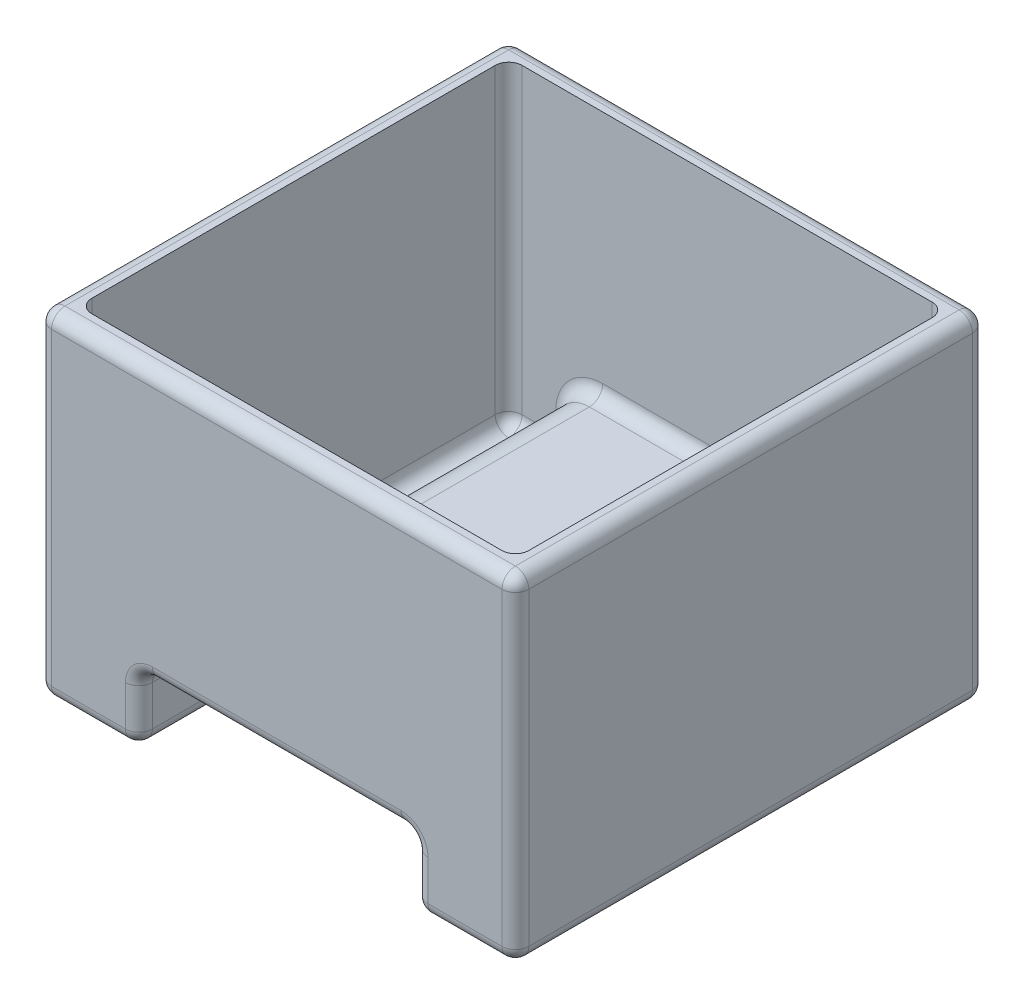
from build123d import *

# Parameters (mm, degrees)
BOSS_EXTRU_2_DEPTH = 70
CONG_4_R           = 2
CONG_3_R           = 2
CONG_5_R           = 2
CONG_6_R           = 2
COQUE1_START       = 3
COQUE1_DEPTH       = 64
CONG_7_R           = 2
CONG_8_R           = 2
CONG_11_R          = 2
CONG_12_R          = 2
CONG_13_R          = 2


# Read off the part's stored shape, not the designer's step: Coque1
with BuildPart() as part:
    # Esquisse2 → Boss.-Extru.2 (new body)
    with BuildSketch(Plane.XY):
        Polygon((-35.5, 10), (-20.5, 10), (-20.5, 20), (20.5, 20), (20.5, 10), (35.5, 10), (35.5, 60), (-35.5, 60), align=None)
    extrude(amount=BOSS_EXTRU_2_DEPTH)

    # Congé4
    cong_4_edges = [part.edges().sort_by_distance(p)[0] for p in [
        (-35.5, 60, 35),
    ]]
    fillet(cong_4_edges, radius=CONG_4_R)

    # Congé3
    cong_3_edges = [part.edges().sort_by_distance(p)[0] for p in [
        (35.5, 60, 35),
    ]]
    fillet(cong_3_edges, radius=CONG_3_R)

    # Congé5
    cong_5_edges = [part.edges().sort_by_distance(p)[0] for p in [
        (20.5, 20, 35),
    ]]
    fillet(cong_5_edges, radius=CONG_5_R)

    # Congé6
    cong_6_edges = [part.edges().sort_by_distance(p)[0] for p in [
        (-20.5, 20, 35),
    ]]
    fillet(cong_6_edges, radius=CONG_6_R)

    # Coque1 outline → Coque1 (cut)
    with BuildSketch(Plane.XY.offset(COQUE1_START)):
        with BuildLine():
            Line((-32.5, 60), (-32.5, 13))
            Line((-32.5, 13), (-23.5, 13))
            Line((-23.5, 13), (-23.5, 18))
            ThreePointArc((-23.5, 18), (-22.035533906, 21.535533906), (-18.5, 23))
            Line((-18.5, 23), (18.5, 23))
            ThreePointArc((18.5, 23), (22.035533906, 21.535533906), (23.5, 18))
            Line((23.5, 18), (23.5, 13))
            Line((23.5, 13), (32.5, 13))
            Line((32.5, 13), (32.5, 60))
            Line((32.5, 60), (-32.5, 60))
        make_face()
    extrude(amount=COQUE1_DEPTH, mode=Mode.SUBTRACT)

    # Congé7
    cong_7_edges = [part.edges().sort_by_distance(p)[0] for p in [
        (35.5, 34, 0),
        (34.914213562, 59.414213562, 0),
        (0, 60, 0),
        (-34.914213562, 59.414213562, 0),
        (-28, 10, 0),
        (-35.5, 10, 35),
        (-35.5, 34, 0),
    ]]
    fillet(cong_7_edges, radius=CONG_7_R)

    # Congé8
    cong_8_edges = [part.edges().sort_by_distance(p)[0] for p in [
        (-20.5, 14, 70),
        (35.5, 10, 36),
        (20.5, 10, 35),
        (-20.5, 10, 36),
        (28, 10, 70),
        (35.5, 34, 70),
        (-35.5, 35, 70),
        (-34.914213562, 59.414213562, 70),
        (0, 60, 70),
        (34.914213562, 59.414213562, 70),
        (20.5, 14, 0),
        (20.5, 14, 70),
        (19.914213562, 19.414213562, 0),
        (19.914213562, 19.414213562, 70),
        (0, 20, 0),
        (0, 20, 70),
        (-19.914213562, 19.414213562, 0),
        (-19.914213562, 19.414213562, 70),
        (-20.5, 15, 0),
        (34.914213562, 10, 0.585786438),
        (-27, 10, 70),
        (-20.5, 10.585786438, 0.585786438),
        (-34.914213562, 10.585786438, 70),
        (27, 10, 0),
    ]]
    fillet(cong_8_edges, radius=CONG_8_R)

    # Congé11
    cong_11_edges = [part.edges().sort_by_distance(p)[0] for p in [
        (-23.5, 15.5, 3),
        (0, 23, 3),
        (23.5, 15.5, 3),
        (-23.5, 15.5, 67),
        (-22.035533906, 21.535533906, 67),
        (0, 23, 67),
        (22.035533906, 21.535533906, 67),
        (23.5, 15.5, 67),
        (22.035533906, 21.535533906, 3),
        (-22.035533906, 21.535533906, 3),
    ]]
    fillet(cong_11_edges, radius=CONG_11_R)

    # Congé12
    cong_12_edges = [part.edges().sort_by_distance(p)[0] for p in [
        (-32.5, 36.5, 3),
        (32.5, 36.5, 3),
        (32.5, 36.5, 67),
        (-32.5, 36.5, 67),
    ]]
    fillet(cong_12_edges, radius=CONG_12_R)

    # Congé13
    cong_13_edges = [part.edges().sort_by_distance(p)[0] for p in [
        (-23.5, 13, 35),
        (28, 13, 67),
        (-24.085786438, 13, 3.585786438),
        (-24.085786438, 13, 66.414213562),
        (23.5, 13, 35),
        (28, 13, 3),
        (24.085786438, 13, 3.585786438),
        (24.085786438, 13, 66.414213562),
        (-32.5, 13, 35),
        (-28, 13, 67),
        (-28, 13, 3),
        (-31.914213562, 13, 3.585786438),
        (-31.914213562, 13, 66.414213562),
        (32.5, 13, 35),
        (31.914213562, 13, 3.585786438),
        (31.914213562, 13, 66.414213562),
    ]]
    fillet(cong_13_edges, radius=CONG_13_R)


solid = part.part
